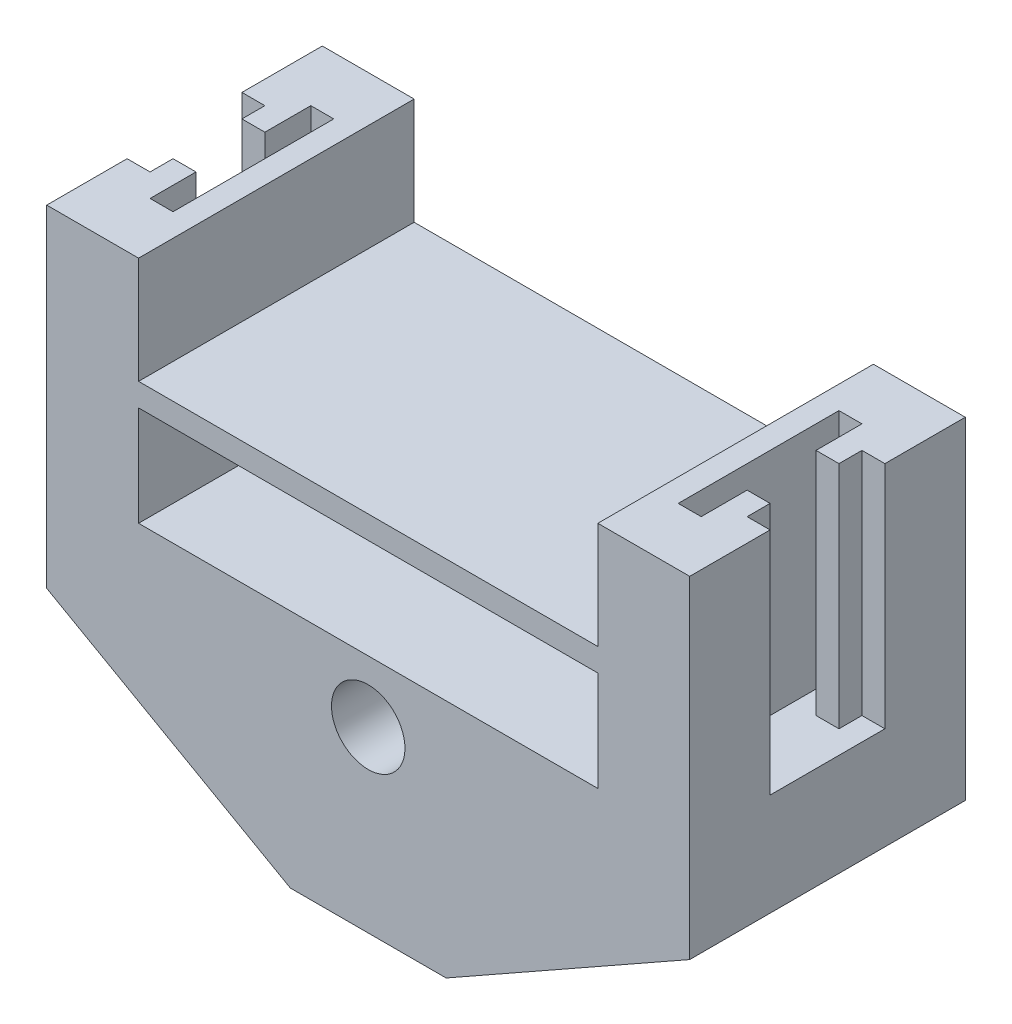
from build123d import *

# Parameters (mm, degrees)
BOSS_EXTRUDE2_DEPTH            = 30
BOSS_EXTRUDE2_DEPTH_BACK       = 30
EXTRUDE_THIN2_START            = -25
EXTRUDE_THIN2_DEPTH            = 50
SKETCH2_W                      = 60
SKETCH2_H                      = 5
BOSS_EXTRUDE3_DEPTH            = 100
BOSS_EXTRUDE4_DEPTH            = 30
BOSS_EXTRUDE4_DEPTH_BACK       = 30
CUT_EXTRUDE2_REACH             = 143.361
SKETCH4_W                      = 60
SKETCH4_H                      = 5
CUT_EXTRUDE2_DIRECTION_2_REACH = 143.361
BOSS_EXTRUDE5_DEPTH            = 30
BOSS_EXTRUDE5_DEPTH_BACK       = 30
DRONE_ARM_FIT_CUT_DEPTH        = 50


# Read off the part's stored shape, not the designer's step: Extrude-Thin2
with BuildPart() as part:
    # Sketch1 → Boss-Extrude2 (new, two sides: drawn at the far end of the back side and taken through both)
    with BuildSketch(Plane.XY.offset(-BOSS_EXTRUDE2_DEPTH_BACK)):
        Polygon((-13.01396445, -23.830717844), (0, -23.830717844), (0, -18.830717844), (-11.698214449, -18.830717844), (-50, 2.827283512), (-50, 13.432214294), (-55, 13.432214294), (-55, -0.089432632), align=None)
        Polygon((0, -18.830717844), (0, -23.830717844), (13.01396445, -23.830717844), (55, -0.089432632), (55, 13.432214294), (50, 13.432214294), (50, 2.827283512), (11.698214449, -18.830717844), align=None)
        with BuildLine():
            Line((-11.698214449, -18.830717844), (0, -18.830717844))
            Line((0, -18.830717844), (0, -8))
            ThreePointArc((0, -8), (-8, 0), (0, 8))
            Line((0, 8), (0, 13.432214294))
            Line((0, 13.432214294), (-50, 13.432214294))
            Line((-50, 13.432214294), (-50, 2.827283512))
            Line((-50, 2.827283512), (-11.698214449, -18.830717844))
        make_face()
        with BuildLine():
            Line((0, -8), (0, -18.830717844))
            Line((0, -18.830717844), (11.698214449, -18.830717844))
            Line((11.698214449, -18.830717844), (50, 2.827283512))
            Line((50, 2.827283512), (50, 13.432214294))
            Line((50, 13.432214294), (0, 13.432214294))
            Line((0, 13.432214294), (0, 8))
            ThreePointArc((0, 8), (5.656854249, 5.656854249), (8, 0))
            ThreePointArc((8, 0), (5.656854249, -5.656854249), (0, -8))
        make_face()
    extrude(amount=BOSS_EXTRUDE2_DEPTH + BOSS_EXTRUDE2_DEPTH_BACK)

    # Extrude-Thin2 outline → Extrude-Thin2 (add)
    with BuildSketch(Plane.XY.offset(EXTRUDE_THIN2_START)):
        Polygon((50, 13.432214294), (55, 13.432214294), (55, 68.432214294), (-55, 68.432214294), (-55, 13.432214294), (-50, 13.432214294), (-50, 63.432214294), (50, 63.432214294), align=None)
    extrude(amount=EXTRUDE_THIN2_DEPTH)

    # Sketch2 → Boss-Extrude3 (add)
    with BuildSketch(Plane.ZY.offset(-50)):
        with Locations((0, 37.694873029)):
            Rectangle(SKETCH2_W, SKETCH2_H)
    extrude(amount=BOSS_EXTRUDE3_DEPTH)

    # Sketch1<6> → Boss-Extrude4 (add, two sides: drawn at the far end of the back side and taken through both)
    with BuildSketch(Plane.XY.offset(-BOSS_EXTRUDE4_DEPTH_BACK)):
        Polygon((-55, -0.089432632), (-55, 13.432214294), (-70, 13.432214294), (-70, -8.839581066), (-16.961214453, -38.830717844), (16.961214453, -38.830717844), (70, -8.839581066), (70, 13.432214294), (55, 13.432214294), (55, -0.089432632), (13.01396445, -23.830717844), (-13.01396445, -23.830717844), align=None)
    extrude(amount=BOSS_EXTRUDE4_DEPTH + BOSS_EXTRUDE4_DEPTH_BACK)

    # Cut-Extrude2: up to this face of the body (flat: up to its plane)
    cut_extrude2_end = Plane(part.part.faces().sort_by_distance((-55, 40.932214294, 0))[0])
    # Sketch4 → Cut-Extrude2 (cut, up to the picked face)
    with BuildSketch(Plane(origin=(-50, 0, 0), x_dir=(0, 0, -1), z_dir=(1, 0, 0)), mode=Mode.PRIVATE) as cut_extrude2_sk1:
        with Locations((0, 65.932214294)):
            Rectangle(SKETCH4_W, SKETCH4_H)
    cut_extrude2_tool1 = split(extrude(cut_extrude2_sk1.sketch, amount=-CUT_EXTRUDE2_REACH, mode=Mode.PRIVATE), bisect_by=cut_extrude2_end, keep=Keep.BOTH, mode=Mode.PRIVATE)
    add(cut_extrude2_tool1.solids().sort_by(Axis((-50, 65.932214, 0), (-1, 0, 0)))[0], mode=Mode.SUBTRACT)

    # Cut-Extrude2 direction 2: up to this face of the body (flat: up to its plane)
    cut_extrude2_direction_2_end = Plane(part.part.faces().sort_by_distance((55, 40.932214294, 0))[0])
    # Sketch4 → Cut-Extrude2 direction 2 (cut, up to the picked face)
    with BuildSketch(Plane(origin=(-50, 0, 0), x_dir=(0, 0, -1), z_dir=(1, 0, 0)), mode=Mode.PRIVATE) as cut_extrude2_direction_2_sk1:
        with Locations((0, 65.932214294)):
            Rectangle(SKETCH4_W, SKETCH4_H)
    cut_extrude2_direction_2_tool1 = split(extrude(cut_extrude2_direction_2_sk1.sketch, amount=CUT_EXTRUDE2_DIRECTION_2_REACH, mode=Mode.PRIVATE), bisect_by=cut_extrude2_direction_2_end, keep=Keep.BOTH, mode=Mode.PRIVATE)
    add(cut_extrude2_direction_2_tool1.solids().sort_by(Axis((-50, 65.932214, 0), (1, 0, 0)))[0], mode=Mode.SUBTRACT)

    # Sketch1<7> → Boss-Extrude5 (add, two sides: drawn at the far end of the back side and taken through both)
    with BuildSketch(Plane.XY.offset(-BOSS_EXTRUDE5_DEPTH_BACK)):
        Polygon((-70, 13.432214294), (-55, 13.432214294), (-50, 13.432214294), (-50, 38.432214294), (-50, 63.432214294), (-70, 63.432214294), (-70, 38.432214294), align=None)
        Polygon((50, 38.432214294), (50, 13.432214294), (55, 13.432214294), (70, 13.432214294), (70, 38.432214294), (70, 63.432214294), (50, 63.432214294), align=None)
    extrude(amount=BOSS_EXTRUDE5_DEPTH + BOSS_EXTRUDE5_DEPTH_BACK)

    # Sketch7 → Drone Arm fit cut (cut)
    with BuildSketch(Plane(origin=(0, 63.432214294, 0), x_dir=(1, 0, 0), z_dir=(0, 1, 0))):
        Polygon((-70, -12.5), (-70, 12.5), (-65, 12.5), (-65, 7.5), (-60, 7.5), (-60, 12.5), (-60, 17.5), (-55, 17.5), (-55, -17.5), (-60, -17.5), (-60, -12.5), (-60, -7.5), (-65, -7.5), (-65, -12.5), align=None)
    drone_arm_fit_cut = extrude(amount=-DRONE_ARM_FIT_CUT_DEPTH, mode=Mode.SUBTRACT)

    # Mirror Drone arm fit cut: Drone Arm fit cut across plane
    add(drone_arm_fit_cut.mirror(Plane(origin=(0, 0, 0), x_dir=(0, 0, 1), z_dir=(1, 0, 0))), mode=Mode.SUBTRACT)


solid = part.part
